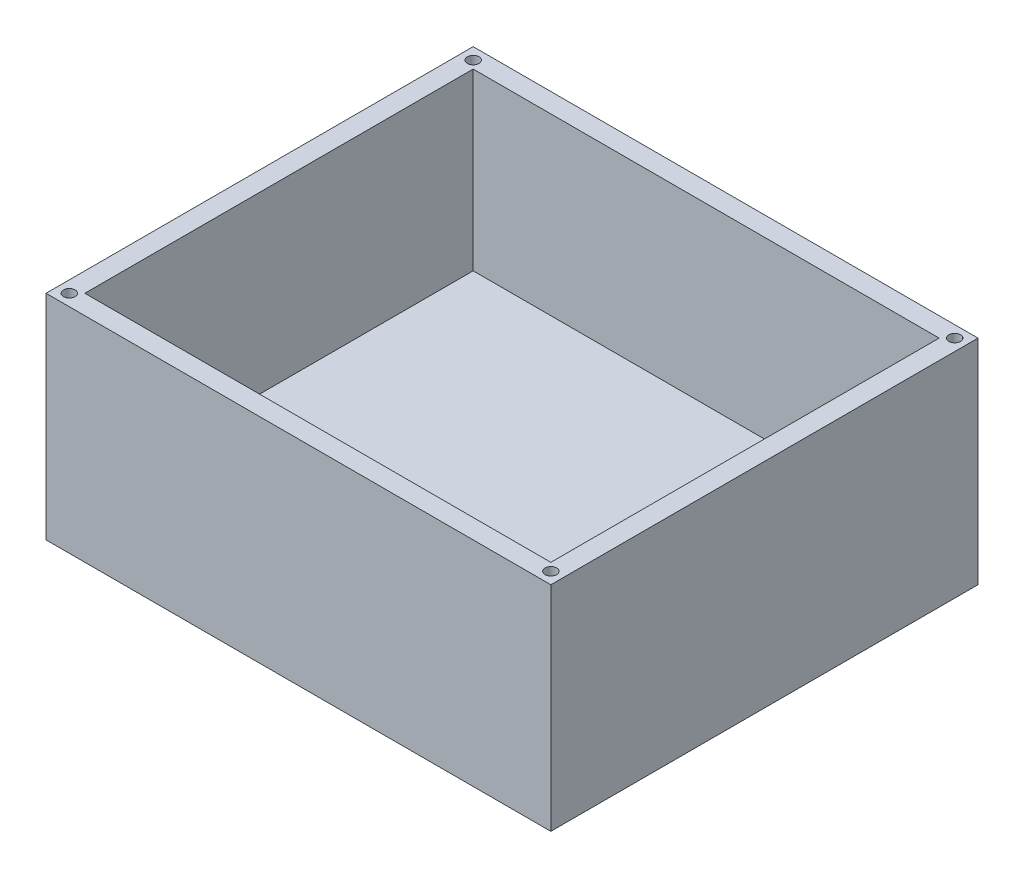
from build123d import *

# Parameters (mm, degrees)
SKETCH1_W               = 130
SKETCH1_H               = 110
BOSS_EXTRUDE1_DEPTH     = 10
SKETCH2_W               = 130
SKETCH2_H               = 110
SKETCH2_W_2             = 120
SKETCH2_H_2             = 100
BOSS_EXTRUDE2_DEPTH     = 45
SKETCH3_R               = 1.5
CUT_EXTRUDE3_DEPTH      = 20
MIRROR2_COPY_1_SKETCH_R = 1.5
MIRROR2_COPY_1_DEPTH    = 20
MIRROR2_COPY_2_SKETCH_R = 1.5
MIRROR2_COPY_2_DEPTH    = 20


with BuildPart() as part:
    # Sketch1 → Boss-Extrude1 (new body)
    with BuildSketch(Plane(origin=(0, 0, 0), x_dir=(1, 0, 0), z_dir=(0, 1, 0))):
        Rectangle(SKETCH1_W, SKETCH1_H)
    extrude(amount=BOSS_EXTRUDE1_DEPTH)

    # Sketch2 → Boss-Extrude2 (add)
    with BuildSketch(Plane(origin=(0, 10, 0), x_dir=(1, 0, 0), z_dir=(0, 1, 0))):
        Rectangle(SKETCH2_W, SKETCH2_H)
        Rectangle(SKETCH2_W_2, SKETCH2_H_2, mode=Mode.SUBTRACT)
    extrude(amount=BOSS_EXTRUDE2_DEPTH)

    # Sketch3 → Cut-Extrude3 (cut)
    with BuildSketch(Plane(origin=(0, 55, 0), x_dir=(1, 0, 0), z_dir=(0, 1, 0))):
        with Locations((-62, 52)):
            Circle(SKETCH3_R)
    cut_extrude3 = extrude(amount=-CUT_EXTRUDE3_DEPTH, mode=Mode.SUBTRACT)

    # Mirror1: Cut-Extrude3 across plane
    add(cut_extrude3.mirror(Plane.XY), mode=Mode.SUBTRACT)

    # Mirror2 copy 1 sketch → Mirror2 copy 1 (cut)
    with BuildSketch(Plane(origin=(0, 55, 0), x_dir=(-1, 0, 0), z_dir=(0, 1, 0))):
        with Locations((-62, 52)):
            Circle(MIRROR2_COPY_1_SKETCH_R)
    extrude(amount=-MIRROR2_COPY_1_DEPTH, mode=Mode.SUBTRACT)

    # Mirror2 copy 2 sketch → Mirror2 copy 2 (cut)
    with BuildSketch(Plane(origin=(0, 55, 0), x_dir=(-1, 0, 0), z_dir=(0, 1, 0))):
        with Locations((-62, -52)):
            Circle(MIRROR2_COPY_2_SKETCH_R)
    extrude(amount=-MIRROR2_COPY_2_DEPTH, mode=Mode.SUBTRACT)


solid = part.part
